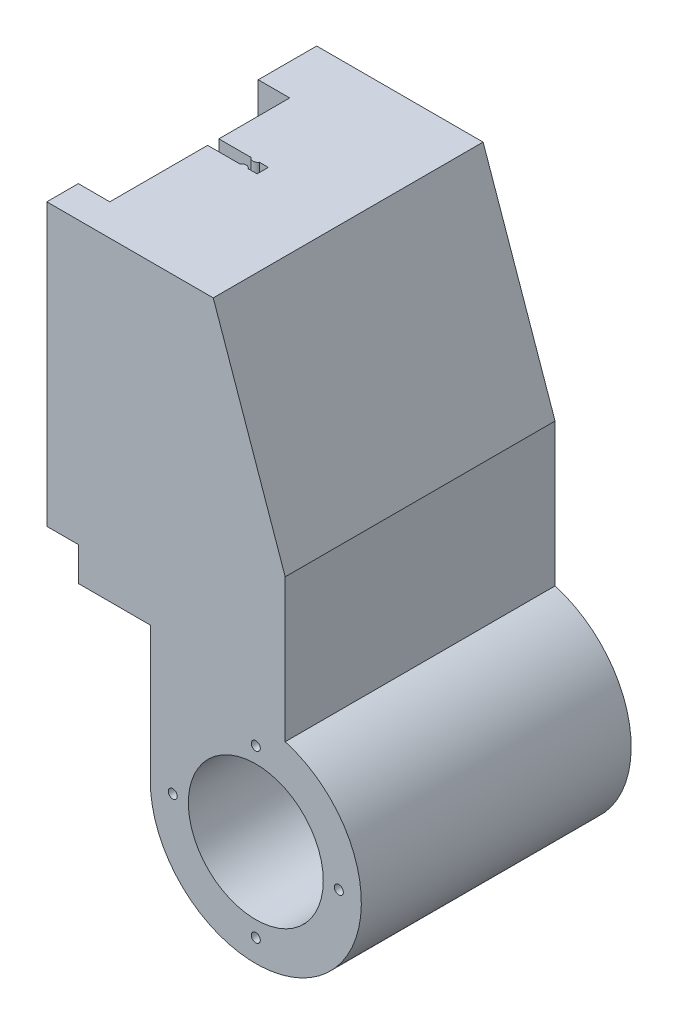
from build123d import *

# Parameters (mm, degrees)
BOSS_EXTRUDE1_OUTLINE_R = 16
BOSS_EXTRUDE1_DEPTH     = 60
BOSS_EXTRUDE2_START     = -60
BOSS_EXTRUDE2_DEPTH     = 60
CUT_EXTRUDE1_DEPTH      = 145.395578885
CUT_EXTRUDE2_DEPTH      = 145.395578885
SKETCH5_W               = 40
SKETCH5_H               = 37.745966692
CUT_EXTRUDE5_DEPTH      = 146.348374233
BOSS_EXTRUDE3_START     = -60
BOSS_EXTRUDE3_DEPTH     = 60
CUT_EXTRUDE6_START      = -60
SKETCH10_4_R            = 1
CUT_EXTRUDE6_DEPTH      = 60
CUT_EXTRUDE7_DEPTH      = 60
BOSS_EXTRUDE4_DEPTH     = 70
SKETCH12_W              = 7
SKETCH12_H              = 13
SKETCH12_H_2            = 7
BOSS_EXTRUDE5_DEPTH     = 62.5
SKETCH13_W              = 11
SKETCH13_H              = 2.5
CUT_EXTRUDE8_DEPTH      = 40


# Read off the part's stored shape, not the designer's step: Boss-Extrude1, Boss-Extrude3
with BuildPart() as part:
    # Boss-Extrude1 outline → Boss-Extrude1 (new body)
    with BuildSketch(Plane.XY.offset(0.755461794)):
        with Locations((-30.851105688, 17.572500308)):
            Circle(BOSS_EXTRUDE1_OUTLINE_R)
        with BuildLine():
            Line((-28.166301776, 21.908607365), (-28.260226262, 22.19606428))
            ThreePointArc((-28.260226262, 22.19606428), (-28.158199405, 22.137394146), (-28.057500467, 22.076472985))
            Line((-28.057500467, 22.076472985), (-28.166301776, 21.908607365))
        make_face(mode=Mode.SUBTRACT)
    extrude(amount=BOSS_EXTRUDE1_DEPTH)

    # Sketch2 → Boss-Extrude2 (add)
    with BuildSketch(Plane.XY.offset(60.755461794).offset(BOSS_EXTRUDE2_START)):
        with BuildLine():
            Line((-60.851105688, 17.572500308), (-46.851105688, 17.572500308))
            ThreePointArc((-46.851105688, 17.572500308), (-30.851105688, 33.572500308), (-14.851105688, 17.572500308))
            Line((-14.851105688, 17.572500308), (-14.851105688, 71.858214594))
            Line((-14.851105688, 71.858214594), (-30.851105688, 117.572500308))
            Line((-30.851105688, 117.572500308), (-60.851105688, 117.572500308))
            Line((-60.851105688, 117.572500308), (-60.851105688, 17.572500308))
        make_face()
    extrude(amount=BOSS_EXTRUDE2_DEPTH)

    # Sketch3 → Cut-Extrude1 (cut, through all)
    with BuildSketch(Plane(origin=(0, 117.572500308, 0), x_dir=(1, 0, 0), z_dir=(0, 1, 0))):
        with BuildLine():
            Line((-60.851105688, -29.505461794), (-60.851105688, -32.005461794))
            Line((-60.851105688, -32.005461794), (-53.678502861, -32.005461794))
            ThreePointArc((-53.678502861, -32.005461794), (-52.758859998, -31.502501818), (-51.839217136, -32.005461794))
            Line((-51.839217136, -32.005461794), (-49.851105688, -32.005461794))
            Line((-49.851105688, -32.005461794), (-49.851105688, -29.505461794))
            Line((-49.851105688, -29.505461794), (-51.839217136, -29.505461794))
            ThreePointArc((-51.839217136, -29.505461794), (-52.758859998, -30.00842177), (-53.678502861, -29.505461794))
            Line((-53.678502861, -29.505461794), (-60.851105688, -29.505461794))
        make_face()
    extrude(amount=-CUT_EXTRUDE1_DEPTH, mode=Mode.SUBTRACT)

    # Sketch4 → Cut-Extrude2 (cut, through all)
    with BuildSketch(Plane(origin=(0, 117.572500308, 0), x_dir=(1, 0, 0), z_dir=(0, 1, 0))):
        Polygon((-60.851105688, -27.255461794), (-44.851105688, -0.755461794), (-60.851105688, -0.755461794), align=None)
        Polygon((-60.851105688, -34.255461794), (-44.851105688, -60.755461794), (-60.851105688, -60.755461794), align=None)
    extrude(amount=-CUT_EXTRUDE2_DEPTH, mode=Mode.SUBTRACT)

    # Sketch5 → Cut-Extrude5 (cut, through all)
    with BuildSketch(Plane(origin=(0, 0, 0.755461794), x_dir=(-1, 0, 0), z_dir=(0, 0, -1))):
        with Locations((64.851105688, 28.699516962)):
            Rectangle(SKETCH5_W, SKETCH5_H)
    extrude(amount=-CUT_EXTRUDE5_DEPTH, mode=Mode.SUBTRACT)

    # Boss-Extrude3 outline → Boss-Extrude3 (add)
    with BuildSketch(Plane.XY.offset(60.755461794).offset(BOSS_EXTRUDE3_START)):
        with BuildLine():
            ThreePointArc((-14.851105688, 17.572500308), (-24.419989547, 2.92187762), (-41.681198835, 5.795018301))
            ThreePointArc((-41.681198835, 5.795018301), (-2.90297286, 3.119259484), (-14.851105688, 40.107806589))
            Line((-14.851105688, 40.107806589), (-14.851105688, 17.572500308))
        make_face()
    extrude(amount=BOSS_EXTRUDE3_DEPTH)

    # Sketch10<4> → Cut-Extrude6 (cut)
    with BuildSketch(Plane.XY.offset(60.755461794).offset(CUT_EXTRUDE6_START)):
        with BuildLine():
            ThreePointArc((-44.851105688, 9.826533616), (-43.428731074, 7.682943208), (-41.681198835, 5.795018301))
            ThreePointArc((-41.681198835, 5.795018301), (-44.044774342, 11.474193332), (-44.851105688, 17.572500308))
            Line((-44.851105688, 17.572500308), (-44.851105688, 9.826533616))
        make_face()
        with BuildLine():
            ThreePointArc((-40.851105688, 17.572500308), (-39.851105688, 16.572500308), (-38.851105688, 17.572500308))
            Line((-38.851105688, 17.572500308), (-40.851105688, 17.572500308))
        make_face()
        with BuildLine():
            Line((-40.851105688, 17.572500308), (-38.851105688, 17.572500308))
            ThreePointArc((-38.851105688, 17.572500308), (-39.851105688, 18.572500308), (-40.851105688, 17.572500308))
        make_face()
        with BuildLine():
            ThreePointArc((-20.387105202, -0.891500177), (-20.679998421, -0.184393396), (-21.387105202, 0.108499823))
            Line((-21.387105202, 0.108499823), (-21.387105202, -1.891500177))
            ThreePointArc((-21.387105202, -1.891500177), (-20.679998421, -1.598606959), (-20.387105202, -0.891500177))
        make_face()
        with BuildLine():
            Line((-21.387105202, -1.891500177), (-21.387105202, 0.108499823))
            ThreePointArc((-21.387105202, 0.108499823), (-22.387105202, -0.891500177), (-21.387105202, -1.891500177))
        make_face()
        with BuildLine():
            ThreePointArc((-2.923104717, 18.572500308), (-3.630211498, 18.27960709), (-3.923104717, 17.572500308))
            Line((-3.923104717, 17.572500308), (-2.923104717, 17.572500308))
            Line((-2.923104717, 17.572500308), (-2.923104717, 18.572500308))
        make_face()
        with BuildLine():
            Line((-2.923104717, 17.572500308), (-3.923104717, 17.572500308))
            ThreePointArc((-3.923104717, 17.572500308), (-2.923104717, 16.572500308), (-1.923104717, 17.572500308))
            ThreePointArc((-1.923104717, 17.572500308), (-2.215997935, 18.27960709), (-2.923104717, 18.572500308))
            Line((-2.923104717, 18.572500308), (-2.923104717, 17.572500308))
        make_face()
        with Locations((-21.387105202, 36.036500794)):
            Circle(SKETCH10_4_R)
    extrude(amount=CUT_EXTRUDE6_DEPTH, mode=Mode.SUBTRACT)

    # Sketch10<5> → Cut-Extrude7 (cut)
    # profile 1 of 6: a face of its own
    with BuildSketch(Plane.XY.offset(60.755461794)):
        with BuildLine():
            ThreePointArc((-14.851105688, 17.572500308), (-16.578334273, 10.341456392), (-21.387105202, 4.671620695))
            Line((-21.387105202, 4.671620695), (-21.387105202, 2.572500308))
            ThreePointArc((-21.387105202, 2.572500308), (-10.780503485, 6.965898591), (-6.387105202, 17.572500308))
            Line((-6.387105202, 17.572500308), (-14.851105688, 17.572500308))
        make_face()
    # profile 2 of 6: a face of its own
    with BuildSketch(Plane.XY.offset(60.755461794)):
        with BuildLine():
            Line((-14.851105688, 31.073637681), (-14.851105688, 17.572500308))
            Line((-14.851105688, 17.572500308), (-6.387105202, 17.572500308))
            ThreePointArc((-6.387105202, 17.572500308), (-8.678053454, 25.539934252), (-14.851105688, 31.073637681))
        make_face()
    # profile 3 of 6: a face of its own
    with BuildSketch(Plane.XY.offset(60.755461794)):
        with BuildLine():
            Line((-30.851105688, 17.572500308), (-21.387105202, 17.572500308))
            Line((-21.387105202, 17.572500308), (-14.851105688, 17.572500308))
            Line((-14.851105688, 17.572500308), (-14.851105688, 31.073637681))
            ThreePointArc((-14.851105688, 31.073637681), (-29.354539146, 30.281552057), (-36.387105202, 17.572500308))
            Line((-36.387105202, 17.572500308), (-30.851105688, 17.572500308))
        make_face()
        with BuildLine():
            Line((-28.166301776, 21.908607365), (-28.260226262, 22.19606428))
            ThreePointArc((-28.260226262, 22.19606428), (-28.158199405, 22.137394146), (-28.057500467, 22.076472985))
            Line((-28.057500467, 22.076472985), (-28.166301776, 21.908607365))
        make_face(mode=Mode.SUBTRACT)
    # profile 4 of 6: a face of its own
    with BuildSketch(Plane.XY.offset(60.755461794)):
        with BuildLine():
            Line((-14.851105688, 17.572500308), (-21.387105202, 17.572500308))
            Line((-21.387105202, 17.572500308), (-21.387105202, 4.671620695))
            ThreePointArc((-21.387105202, 4.671620695), (-16.578334273, 10.341456392), (-14.851105688, 17.572500308))
        make_face()
    # profile 5 of 6: a face of its own
    with BuildSketch(Plane.XY.offset(60.755461794)):
        with BuildLine():
            Line((-21.387105202, 4.671620695), (-21.387105202, 17.572500308))
            Line((-21.387105202, 17.572500308), (-30.851105688, 17.572500308))
            Line((-30.851105688, 17.572500308), (-36.387105202, 17.572500308))
            ThreePointArc((-36.387105202, 17.572500308), (-33.036423327, 8.122982478), (-24.481320238, 2.895108397))
            ThreePointArc((-24.481320238, 2.895108397), (-22.884538469, 3.696845126), (-21.387105202, 4.671620695))
        make_face()
    # profile 6 of 6: a face of its own
    with BuildSketch(Plane.XY.offset(60.755461794)):
        with BuildLine():
            Line((-21.387105202, 2.572500308), (-21.387105202, 4.671620695))
            ThreePointArc((-21.387105202, 4.671620695), (-22.884538469, 3.696845126), (-24.481320238, 2.895108397))
            ThreePointArc((-24.481320238, 2.895108397), (-22.942598907, 2.653370329), (-21.387105202, 2.572500308))
        make_face()
    extrude(amount=-CUT_EXTRUDE7_DEPTH, mode=Mode.SUBTRACT)

    # Sketch11 → Boss-Extrude4 (add)
    with BuildSketch(Plane(origin=(0, 117.572500308, 0), x_dir=(1, 0, 0), z_dir=(0, 1, 0))):
        Polygon((-44.851105688, -0.755461794), (-60.851105688, -0.755461794), (-60.851105688, -27.255461794), align=None)
        Polygon((-60.851105688, -34.255461794), (-60.851105688, -60.755461794), (-44.851105688, -60.755461794), align=None)
    extrude(amount=-BOSS_EXTRUDE4_DEPTH)

    # Sketch12 → Boss-Extrude5 (add)
    with BuildSketch(Plane(origin=(0, 117.572500308, 0), x_dir=(1, 0, 0), z_dir=(0, 1, 0))):
        with Locations((-64.351105688, -7.255461794)):
            Rectangle(SKETCH12_W, SKETCH12_H)
        with Locations((-64.351105688, -57.255461794)):
            Rectangle(SKETCH12_W, SKETCH12_H_2)
    extrude(amount=-BOSS_EXTRUDE5_DEPTH)

    # Sketch13 → Cut-Extrude8 (cut)
    with BuildSketch(Plane.XZ.offset(-47.572500308)):
        with Locations((-55.351105688, 30.755461794)):
            Rectangle(SKETCH13_W, SKETCH13_H)
    extrude(amount=-CUT_EXTRUDE8_DEPTH, mode=Mode.SUBTRACT)


solid = part.part
